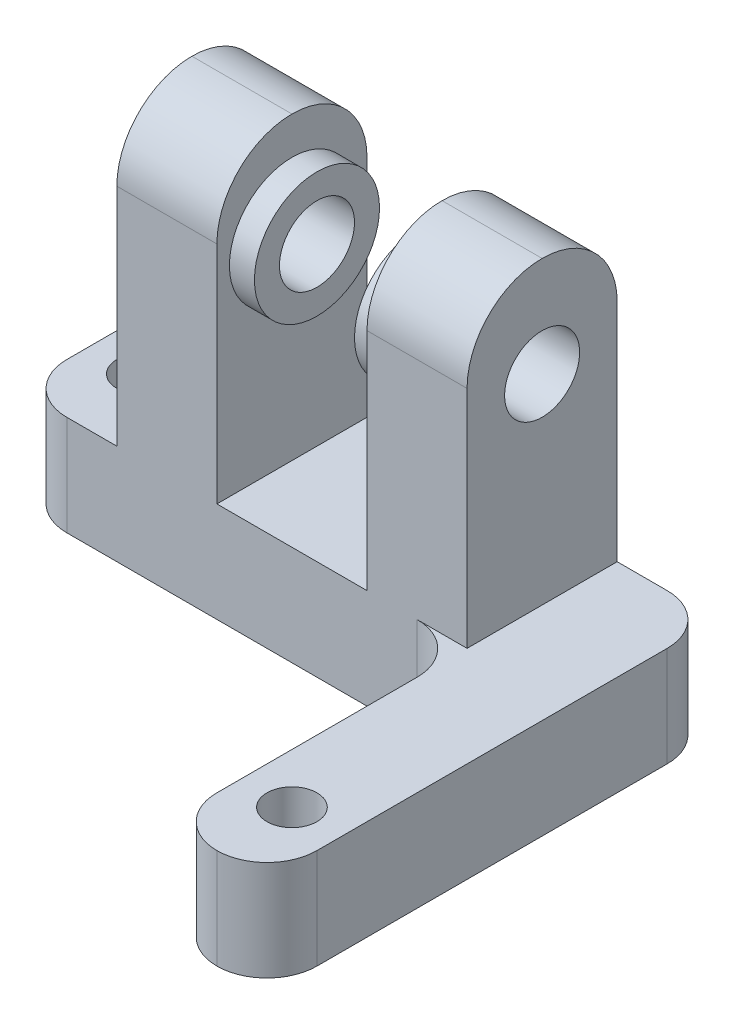
from build123d import *
from build123d.topology import SkipClean

# Parameters (mm, degrees)
SKETCH2_W               = 14
SKETCH2_H               = 6
BOSS_EXTRUDE1_DEPTH     = 4
SKETCH3_W               = 4
SKETCH3_H               = 6
BOSS_EXTRUDE2_DEPTH     = 12
CUT_EXTRUDE1_DEPTH      = 22.470910554
CUT_EXTRUDE1_DEPTH_BACK = 22.470910554
SKETCH4_R               = 1.5
BOSS_EXTRUDE3_START     = 1
SKETCH5_R               = 2.5
SKETCH5_R_2             = 1.5
BOSS_EXTRUDE3_DEPTH     = 1
SKETCH6_R               = 2.5
SKETCH6_R_2             = 1.5
BOSS_EXTRUDE4_DEPTH     = 1
SKETCH7_R               = 1
SKETCH7_W               = 4
SKETCH7_H               = 6
BOSS_EXTRUDE5_DEPTH     = 4
FILLET1_R               = 2
FILLET2_R               = 3


with BuildPart() as part:
    # Sketch2 → Boss-Extrude1 (new body)
    with BuildSketch(Plane(origin=(0, 0, 0), x_dir=(1, 0, 0), z_dir=(0, 1, 0))):
        Rectangle(SKETCH2_W, SKETCH2_H)
    extrude(amount=BOSS_EXTRUDE1_DEPTH)

    # Sketch3 → Boss-Extrude2 (add)
    with BuildSketch(Plane(origin=(0, 4, 0), x_dir=(1, 0, 0), z_dir=(0, 1, 0))):
        with Locations((-5, 0)):
            Rectangle(SKETCH3_W, SKETCH3_H)
        with Locations((5, 0)):
            Rectangle(SKETCH3_W, SKETCH3_H)
    extrude(amount=BOSS_EXTRUDE2_DEPTH)

    # Sketch4 → Cut-Extrude1 (cut, two sides: drawn at the far end of the back side and taken through both)
    with BuildSketch(Plane(origin=(7, 0, 0), x_dir=(0, 0, -1), z_dir=(1, 0, 0)).offset(-CUT_EXTRUDE1_DEPTH_BACK)):
        with Locations((0, 12)):
            Circle(SKETCH4_R)
    extrude(amount=CUT_EXTRUDE1_DEPTH + CUT_EXTRUDE1_DEPTH_BACK, mode=Mode.SUBTRACT)

    # Sketch5 → Boss-Extrude3 (add)
    with BuildSketch(Plane(origin=(-3, 0, 0), x_dir=(0, 0, -1), z_dir=(1, 0, 0)).offset(BOSS_EXTRUDE3_START)):
        with Locations(Location((0, 12, 0), (0, 0, 180))):
            Circle(SKETCH5_R)
        with Locations((0, 12)):
            Circle(SKETCH5_R_2, mode=Mode.SUBTRACT)
    extrude(amount=-BOSS_EXTRUDE3_DEPTH)

    # Sketch6 → Boss-Extrude4 (add)
    with SkipClean():  # the faces are left unmerged after this step: merging them gives an invalid solid
        with BuildSketch(Plane.ZY.offset(-3)):
            with Locations((0, 12)):
                Circle(SKETCH6_R)
            with Locations((0, 12)):
                Circle(SKETCH6_R_2, mode=Mode.SUBTRACT)
        extrude(amount=BOSS_EXTRUDE4_DEPTH)

    # Sketch7 → Boss-Extrude5 (add)
    # profile 1 of 2: a face of its own
    with SkipClean():  # the faces are left unmerged after this step: merging them gives an invalid solid
        with BuildSketch(Plane(origin=(0, 4, 0), x_dir=(1, 0, 0), z_dir=(0, 1, 0))):
            Polygon((11, 3), (11, -3), (11, -11), (11, -15), (7, -15), (7, -11), (7, -3), (7, 3), align=None)
            with Locations(Location((9, -12, 0), (0, 0, 270))):
                Circle(SKETCH7_R, mode=Mode.SUBTRACT)
        # profile 2 of 2: a face of its own
        with BuildSketch(Plane(origin=(0, 4, 0), x_dir=(1, 0, 0), z_dir=(0, 1, 0))):
            with Locations((-9, 0)):
                Rectangle(SKETCH7_W, SKETCH7_H)
            with Locations(Location((-9, 0, 0), (0, 0, 270))):
                Circle(SKETCH7_R, mode=Mode.SUBTRACT)
        extrude(amount=-BOSS_EXTRUDE5_DEPTH)

    # Fillet1
    fillet1_edges = [part.edges().sort_by_distance(p)[0] for p in [
        (-11, 2, -3),
        (11, 2, -3),
        (-11, 2, 3),
        (7, 2, 3),
        (11, 2, 15),
        (7, 2, 15),
    ]]
    fillet(fillet1_edges, radius=FILLET1_R - 0.0001)  # a hair under: the kernel refuses the full size

    # Fillet2
    fillet2_edges = [part.edges().sort_by_distance(p)[0] for p in [
        (-5, 16, -3),
        (5, 16, -3),
        (5, 16, 3),
        (-5, 16, 3),
    ]]
    fillet(fillet2_edges, radius=FILLET2_R - 0.0001)  # a hair under: the kernel refuses the full size


solid = part.part
